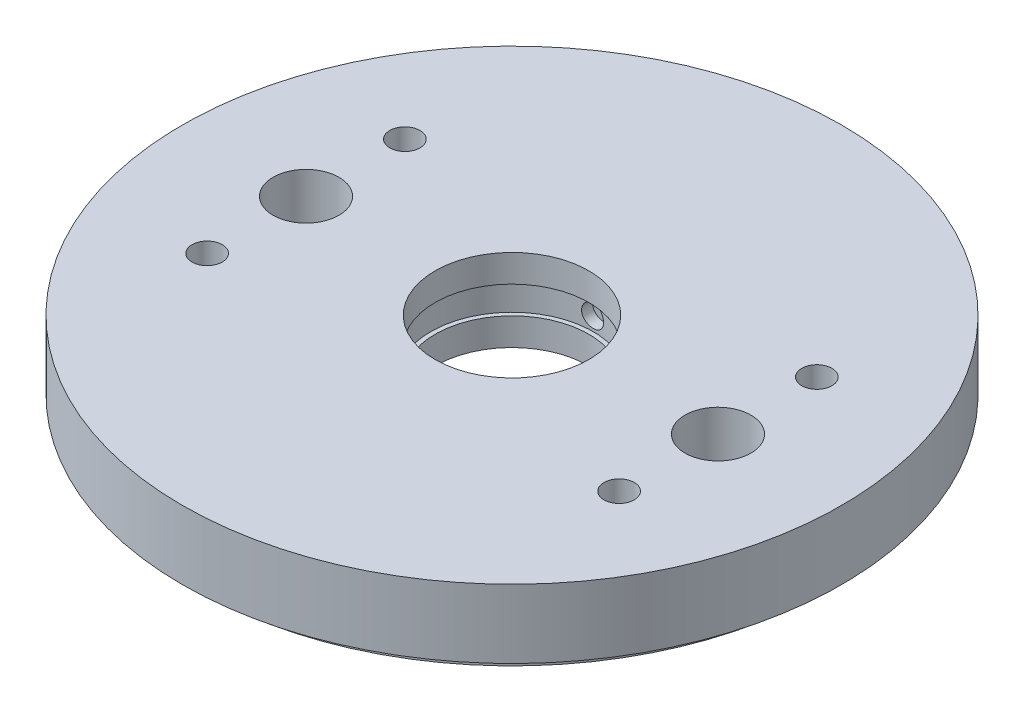
from build123d import *

# Parameters (mm, degrees)
SKETCH1_R            = 57
EXTRUDE4_DEPTH       = 7.5
EXTRUDE5_DEPTH       = 7.5
EXTRUDE5_DEPTH_BACK  = 5
SKETCH_R             = 60
SKETCH_R_2           = 57
SKETCH2_R            = 6
SKETCH2_R_2          = 14
EXTRUDE6_DEPTH       = 87.168439698
M5_CLEARANCE_HOLE1_D = 5.5
SKETCH6_R            = 14.8
EXTRUDE7_DEPTH       = 2.5
EXTRUDE8_START       = -16.8000001
EXTRUDE8_OUTLINE_R   = 2
EXTRUDE8_DEPTH       = 2.135757978
EXTRUDE8_START_2     = -3
EXTRUDE8_2_DEPTH     = 6


with BuildPart() as part:
    # Sketch1 → Extrude4 (new, symmetric)
    with BuildSketch(Plane(origin=(0, 0, 0), x_dir=(1, 0, 0), z_dir=(0, 1, 0))):
        with Locations(Location((0, 0, 0), (0, 0, 270))):
            Circle(SKETCH1_R)
    extrude(amount=EXTRUDE4_DEPTH, both=True)

    # Sketch → Extrude5 (add, two sides: drawn at the far end of the back side and taken through both)
    with BuildSketch(Plane(origin=(0, 0, 0), x_dir=(1, 0, 0), z_dir=(0, 1, 0)).offset(-EXTRUDE5_DEPTH_BACK)):
        with Locations(Location((0, 0, 0), (0, 0, 270))):
            Circle(SKETCH_R)
        with Locations(Location((0, 0, 0), (0, 0, 270))):
            Circle(SKETCH_R_2, mode=Mode.SUBTRACT)
    extrude(amount=EXTRUDE5_DEPTH + EXTRUDE5_DEPTH_BACK)

    # Sketch2 → Extrude6 (cut, through all)
    with BuildSketch(Plane(origin=(0, 7.5, 0), x_dir=(1, 0, 0), z_dir=(0, 1, 0))):
        with Locations(Location((-37.5, 0, 0), (0, 0, 270))):
            Circle(SKETCH2_R)
        with Locations(Location((37.5, 0, 0), (0, 0, 270))):
            Circle(SKETCH2_R)
        with Locations(Location((0, 0, 0), (0, 0, 270))):
            Circle(SKETCH2_R_2)
    extrude(amount=-EXTRUDE6_DEPTH, mode=Mode.SUBTRACT)

    # M5 Clearance Hole1 (through all)
    with Locations(Plane(origin=(0, 7.5, 0), x_dir=(1, 0, 0), z_dir=(0, 1, 0))):
        with Locations((37.5, 18), (37.5, -18), (-37.5, 18), (-37.5, -18)):
            Hole(M5_CLEARANCE_HOLE1_D / 2)

    # Sketch6 → Extrude7 (cut, symmetric)
    with BuildSketch(Plane(origin=(0, 0, 0), x_dir=(1, 0, 0), z_dir=(0, 1, 0))):
        with Locations(Location((0, 0, 0), (0, 0, 270))):
            Circle(SKETCH6_R)
    extrude(amount=EXTRUDE7_DEPTH, both=True, mode=Mode.SUBTRACT)

    # Extrude8: read off the stored shape, not the designer's step
    # Extrude8 outline → Extrude8 (cut)
    with BuildSketch(Plane.XY.offset(EXTRUDE8_START)):
        Circle(EXTRUDE8_OUTLINE_R)
    extrude(amount=EXTRUDE8_DEPTH, mode=Mode.SUBTRACT)

    # Extrude8 2 outline → Extrude8 2 (add)
    with BuildSketch(Plane(origin=(0, 0, 0), x_dir=(1, 0, 0), z_dir=(0, 1, 0)).offset(EXTRUDE8_START_2)):
        with BuildLine():
            ThreePointArc((-2e-09, 16.8), (1.002059984, 16.770088723), (2.000551768, 16.680461403))
            Line((2.000551768, 16.680461403), (3, 16.56059374))
            Line((3, 16.56059374), (3, 16.8000001))
            Line((3, 16.8000001), (-2e-09, 16.8))
        make_face()
        with BuildLine():
            ThreePointArc((-2.000001192, 16.680527427), (-1.001783219, 16.770105259), (-2e-09, 16.8))
            Line((-2e-09, 16.8), (-3, 16.8000001))
            Line((-3, 16.8000001), (-3, 16.560627213))
            Line((-3, 16.560627213), (-2.000001192, 16.680527427))
        make_face()
    extrude(amount=EXTRUDE8_2_DEPTH)


solid = part.part
